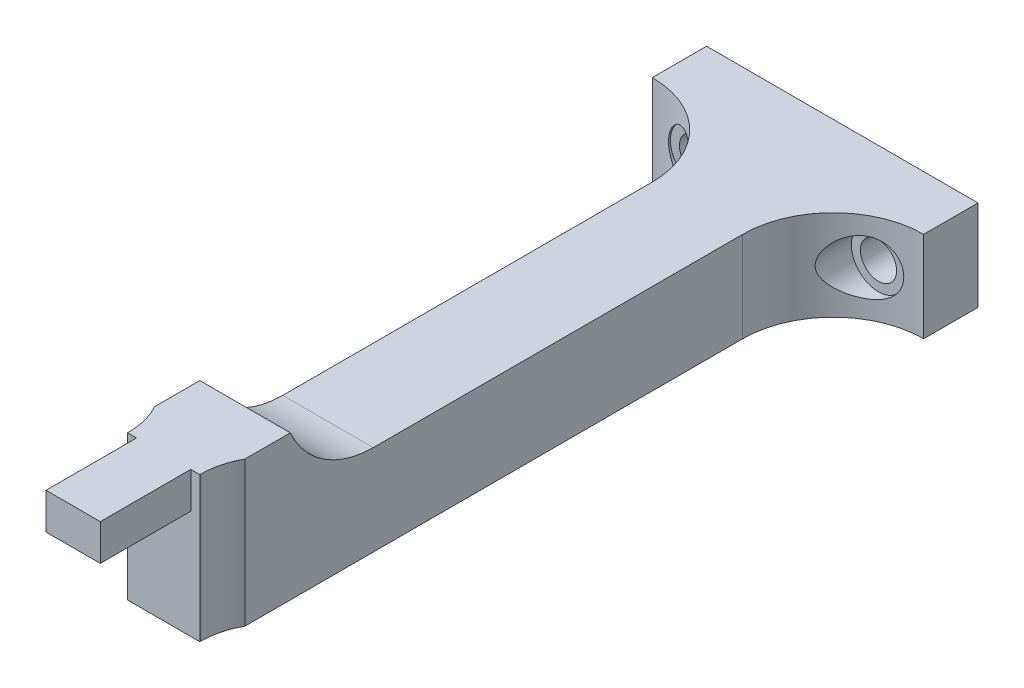
from build123d import *

# Parameters (mm, degrees)
SKETCH1_W           = 10
SKETCH1_H           = 10
BOSS_EXTRUDE1_DEPTH = 65
SKETCH2_W           = 30
SKETCH2_H           = 10
SKETCH2_R           = 2
BOSS_EXTRUDE2_DEPTH = 6
SKETCH3_W           = 10
SKETCH3_H           = 5
BOSS_EXTRUDE3_DEPTH = 6
SKETCH4_W           = 8
SKETCH4_H           = 16
BOSS_EXTRUDE4_DEPTH = 4
SKETCH5_W           = 6
SKETCH5_H           = 4
BOSS_EXTRUDE5_DEPTH = 10
FILLET1_START       = 2.0000001
FILLET1_DEPTH       = 2.9999999
FILLET1_START_2     = -5
FILLET1_2_DEPTH     = 2.999999286
FILLET1_START_3     = -2.000000714
FILLET1_3_DEPTH     = 4.000000814
FILLET1_4_DEPTH     = 10
FILLET1_5_OUTLINE_R = 2
FILLET1_5_DEPTH     = 11
SKETCH6_R           = 3
CUT_EXTRUDE1_DEPTH  = 69
FILLET2_R           = 8


with BuildPart() as part:
    # Sketch1 → Boss-Extrude1 (new body)
    with BuildSketch(Plane.XY):
        Rectangle(SKETCH1_W, SKETCH1_H)
    extrude(amount=BOSS_EXTRUDE1_DEPTH)

    # Sketch2 → Boss-Extrude2 (add)
    with BuildSketch(Plane(origin=(0, 0, 0), x_dir=(-1, 0, 0), z_dir=(0, 0, -1))):
        Rectangle(SKETCH2_W, SKETCH2_H)
        with Locations((-10, 0)):
            Circle(SKETCH2_R, mode=Mode.SUBTRACT)
        with Locations((10, 0)):
            Circle(SKETCH2_R, mode=Mode.SUBTRACT)
    extrude(amount=BOSS_EXTRUDE2_DEPTH)

    # Sketch3 → Boss-Extrude3 (add)
    with BuildSketch(Plane(origin=(0, 5, 0), x_dir=(1, 0, 0), z_dir=(0, 1, 0))):
        with Locations((0, -62.5)):
            Rectangle(SKETCH3_W, SKETCH3_H)
    extrude(amount=BOSS_EXTRUDE3_DEPTH)

    # Sketch4 → Boss-Extrude4 (add)
    with BuildSketch(Plane.XY.offset(65)):
        with Locations((0, 3)):
            Rectangle(SKETCH4_W, SKETCH4_H)
    extrude(amount=BOSS_EXTRUDE4_DEPTH)

    # Sketch5 → Boss-Extrude5 (add)
    with BuildSketch(Plane.XY.offset(69)):
        with Locations((0, 9)):
            Rectangle(SKETCH5_W, SKETCH5_H)
    extrude(amount=BOSS_EXTRUDE5_DEPTH)

    # Fillet1: read off the stored shape, not the designer's step
    # Fillet1 outline → Fillet1 (add)
    with BuildSketch(Plane(origin=(0, 0, 0), x_dir=(1, 0, 0), z_dir=(0, 1, 0)).offset(FILLET1_START)):
        with BuildLine():
            ThreePointArc((-15, 0), (-7.928932188, -2.928932188), (-5, -10))
            Line((-5, -10), (-5, 0))
            Line((-5, 0), (-15, 0))
        make_face()
        with BuildLine():
            Line((5, 0), (5, -10))
            ThreePointArc((5, -10), (7.928932188, -2.928932188), (15, 0))
            Line((15, 0), (5, 0))
        make_face()
    extrude(amount=FILLET1_DEPTH)

    # Fillet1 2 outline → Fillet1 2 (add)
    with BuildSketch(Plane(origin=(0, 0, 0), x_dir=(1, 0, 0), z_dir=(0, 1, 0)).offset(FILLET1_START_2)):
        with BuildLine():
            ThreePointArc((-15, 0), (-7.928932188, -2.928932188), (-5, -10))
            Line((-5, -10), (-5, 0))
            Line((-5, 0), (-15, 0))
        make_face()
        with BuildLine():
            Line((5, 0), (5, -10))
            ThreePointArc((5, -10), (7.928932188, -2.928932188), (15, 0))
            Line((15, 0), (5, 0))
        make_face()
    extrude(amount=FILLET1_2_DEPTH)

    # Fillet1 3 outline → Fillet1 3 (add)
    with BuildSketch(Plane(origin=(0, 0, 0), x_dir=(1, 0, 0), z_dir=(0, 1, 0)).offset(FILLET1_START_3)):
        with BuildLine():
            ThreePointArc((-15, 0), (-7.928932188, -2.928932188), (-5, -10))
            Line((-5, -10), (-5, 0))
            Line((-5, 0), (-15, 0))
        make_face()
        with BuildLine():
            Line((5, 0), (5, -10))
            ThreePointArc((5, -10), (7.928932188, -2.928932188), (15, 0))
            Line((15, 0), (5, 0))
        make_face()
    extrude(amount=FILLET1_3_DEPTH)

    # Fillet1 4 outline → Fillet1 4 (add)
    with BuildSketch(Plane.YZ.offset(FILLET1_START_2)):
        with BuildLine():
            ThreePointArc((5, 50.83484861), (6.633399735, 56.312074185), (11, 60))
            Line((11, 60), (5, 60))
            Line((5, 60), (5, 50.83484861))
        make_face()
    extrude(amount=FILLET1_4_DEPTH)

    # Fillet1 5 outline → Fillet1 5 (cut)
    with BuildSketch(Plane.XY):
        with Locations((10, 0)):
            Circle(FILLET1_5_OUTLINE_R)
        with Locations((-10, 0)):
            Circle(FILLET1_5_OUTLINE_R)
    extrude(amount=FILLET1_5_DEPTH, mode=Mode.SUBTRACT)

    # Sketch6 → Cut-Extrude1 (cut)
    with BuildSketch(Plane.XY.offset(69)):
        with Locations((-10, 0)):
            Circle(SKETCH6_R)
        with Locations((10, 0)):
            Circle(SKETCH6_R)
    extrude(amount=-CUT_EXTRUDE1_DEPTH, mode=Mode.SUBTRACT)

    # Fillet2
    # the kernel refuses this fillet: 8 mm, written as the material it adds along each edge
    with BuildSketch(Plane(origin=(4, -5, 65), x_dir=(1, 0, 0), z_dir=(0, 1, 0))) as fillet2_piece_1:
        with BuildLine():
            CenterArc((8, -3.872983346), FILLET2_R, 151.044975628, 28.955024372)
            Line((0, -3.872983346), (0, 0))
            Line((0, 0), (1, 0))
        make_face()
    extrude(amount=16)
    with BuildSketch(Plane(origin=(-4, 11, 65), x_dir=(0, 0, 1), z_dir=(0, -1, 0))) as fillet2_piece_2:
        with BuildLine():
            CenterArc((3.872983346, 8), FILLET2_R, 241.044975628, 28.955024372)
            Line((0, 1), (0, 0))
            Line((0, 0), (3.872983346, 0))
        make_face()
    extrude(amount=16)


solid = part.part
